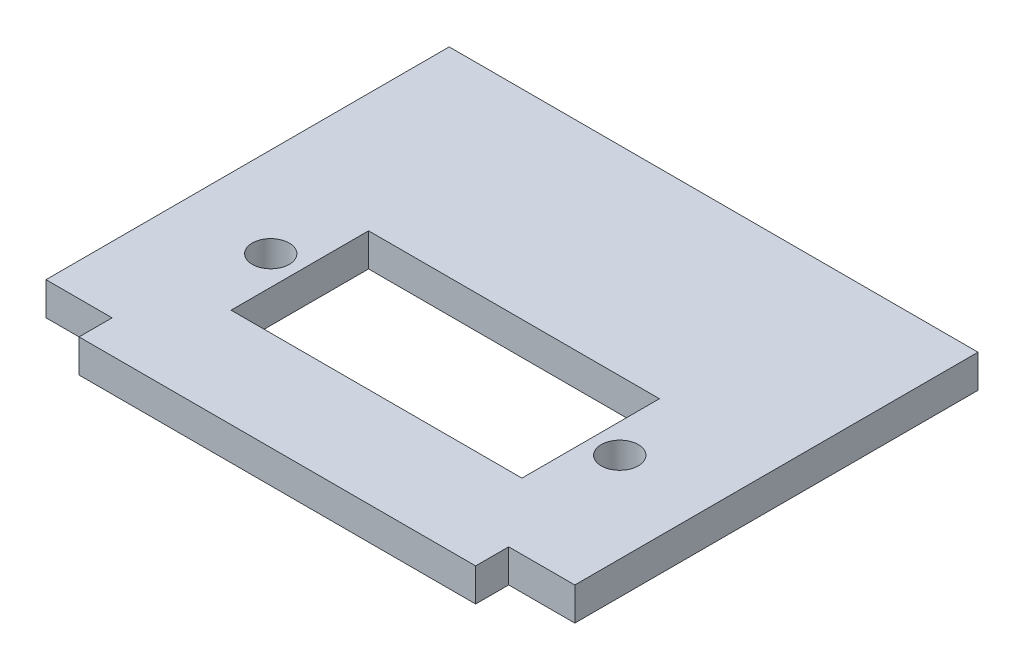
from build123d import *

# Parameters (mm, degrees)
TILT_MOUNT_DEPTH              = 3.175
SERVO_HOLE_SKETCH_W           = 27.94
SERVO_HOLE_SKETCH_H           = 13.208
SERVO_HOLE_DEPTH              = 64.960396929
MOUNTING_HOLES_GUIDE_SKETCH_R = 1.778
MOUNTING_HOLES_DEPTH          = 64.960396929


with BuildPart() as part:
    # Tilt Mount Sketch → Tilt Mount (new body)
    with BuildSketch(Plane(origin=(0, 0, 0), x_dir=(1, 0, 0), z_dir=(0, 1, 0))):
        Polygon((44.45, 0), (50.8, 0), (50.8, 38.73256705), (0, 38.73256705), (0, 0), (6.35, 0), (6.35, -3.175), (44.45, -3.175), align=None)
    extrude(amount=TILT_MOUNT_DEPTH)

    # Servo Hole Sketch → Servo Hole (cut, through all)
    with BuildSketch(Plane(origin=(0, 3.175, 0), x_dir=(1, 0, 0), z_dir=(0, 1, 0))):
        with Locations((25.4, 12.954)):
            Rectangle(SERVO_HOLE_SKETCH_W, SERVO_HOLE_SKETCH_H)
    extrude(amount=-SERVO_HOLE_DEPTH, mode=Mode.SUBTRACT)

    # Mounting Holes Guide Sketch → Mounting Holes (cut, through all)
    with BuildSketch(Plane(origin=(0, 3.175, 0), x_dir=(1, 0, 0), z_dir=(0, 1, 0))):
        with Locations((8.636, 12.954)):
            Circle(MOUNTING_HOLES_GUIDE_SKETCH_R)
        with Locations((42.164, 12.954)):
            Circle(MOUNTING_HOLES_GUIDE_SKETCH_R)
    extrude(amount=-MOUNTING_HOLES_DEPTH, mode=Mode.SUBTRACT)


solid = part.part
